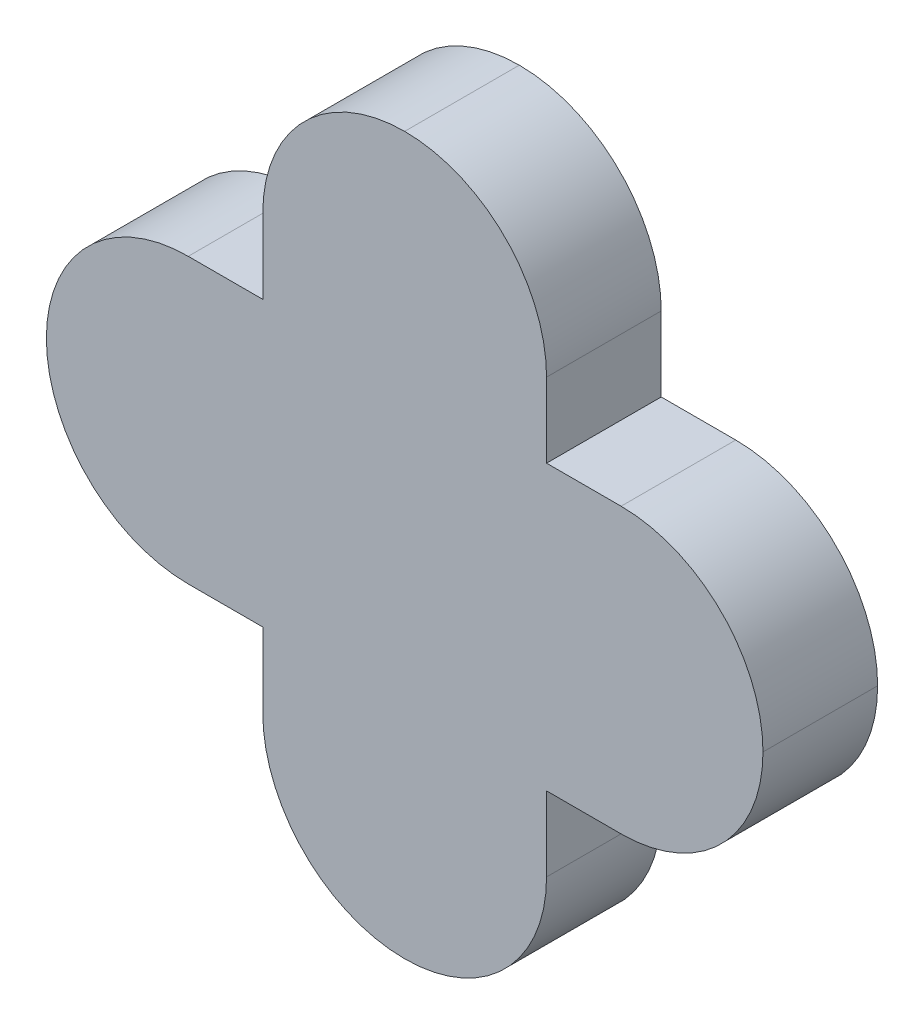
from build123d import *

# Parameters (mm, degrees)
BOSS_EXTRUDE1_DEPTH = 2
FILLET1_R           = 2.475


with BuildPart() as part:
    # Sketch1 → Boss-Extrude1 (new body)
    with BuildSketch(Plane.XY):
        Polygon((2.475, 6.25), (-2.475, 6.25), (-2.475, 2.475), (-6.25, 2.475), (-6.25, -2.475), (-2.475, -2.475), (-2.475, -6.25), (2.475, -6.25), (2.475, -2.475), (6.25, -2.475), (6.25, 2.475), (2.475, 2.475), align=None)
    extrude(amount=BOSS_EXTRUDE1_DEPTH)

    # Fillet1
    fillet1_edges = [part.edges().sort_by_distance(p)[0] for p in [
        (2.475, 6.25, 1),
        (6.25, 2.475, 1),
        (6.25, -2.475, 1),
        (2.475, -6.25, 1),
        (-2.475, -6.25, 1),
        (-6.25, -2.475, 1),
        (-6.25, 2.475, 1),
        (-2.475, 6.25, 1),
    ]]
    fillet(fillet1_edges, radius=FILLET1_R - 0.0001)  # a hair under: the kernel refuses the full size


solid = part.part
